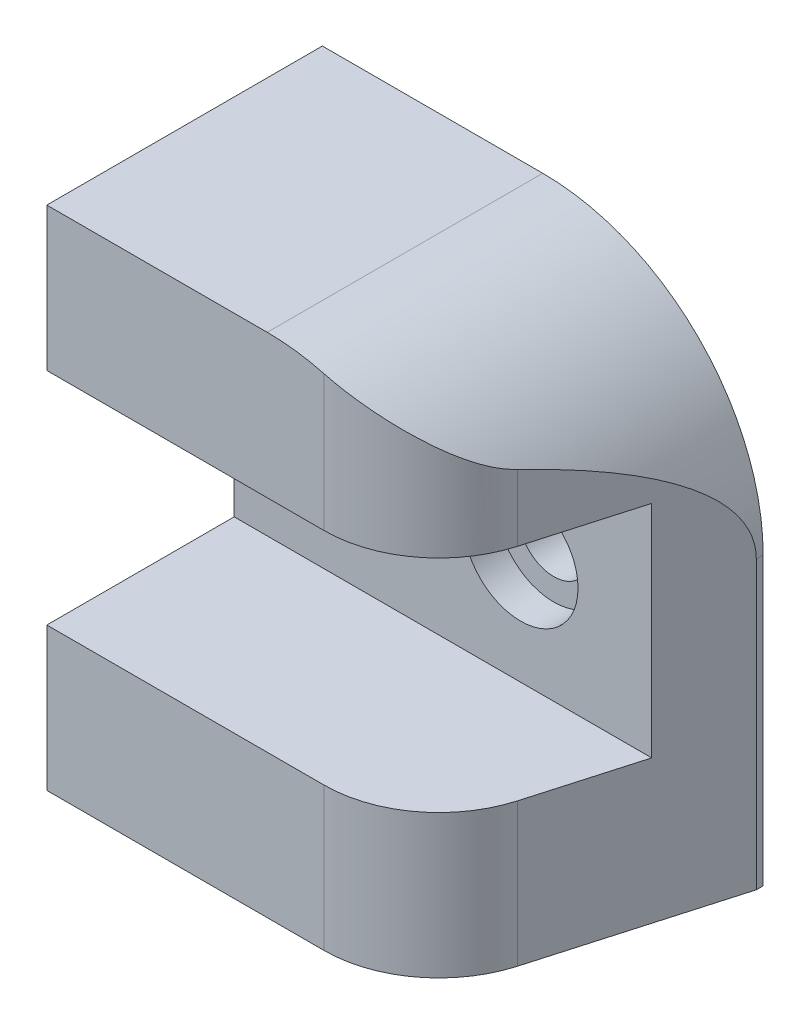
from build123d import *

# Parameters (mm, degrees)
EXTRUDE_1_DEPTH              = 12.5
CUT_EXTRUDE_1_DEPTH          = 26.5
SKETCH_3_W                   = 20
SKETCH_3_H                   = 10
CUT_EXTRUDE_2_DEPTH          = 8.5
HOLE_WIZARD_M3_1_D           = 3.2
HOLE_WIZARD_M3_1_CBORE_D     = 5.2
HOLE_WIZARD_M3_1_CBORE_DEPTH = 1.5


with BuildPart() as part:
    # 草图1 → 凸台-拉伸1 (new body)
    with BuildSketch(Plane.XY):
        with BuildLine():
            Line((130, 82), (110, 82))
            Line((110, 82), (110, 105))
            Line((110, 105), (120, 105))
            ThreePointArc((120, 105), (127.071067812, 102.071067812), (130, 95))
            Line((130, 95), (130, 82))
        make_face()
    extrude(amount=EXTRUDE_1_DEPTH)

    # 草图2 → 切除-拉伸1 (cut)
    with BuildSketch(Plane(origin=(0, 105, 0), x_dir=(1, 0, 0), z_dir=(0, 1, 0))):
        with BuildLine():
            Line((127.585381626, -8.731991651), (130.006476625, -0.288629981))
            Line((130.006476625, -0.288629981), (130.323618549, -12.5))
            Line((130.323618549, -12.5), (122.585065658, -12.5))
            ThreePointArc((122.585065658, -12.5), (125.715602621, -11.452536985), (127.585381626, -8.731991651))
        make_face()
    extrude(amount=-CUT_EXTRUDE_1_DEPTH, mode=Mode.SUBTRACT)

    # 草图3 → 切除-拉伸2 (cut)
    with BuildSketch(Plane.XY.offset(12.5)):
        with Locations((120, 93.5)):
            Rectangle(SKETCH_3_W, SKETCH_3_H)
    extrude(amount=-CUT_EXTRUDE_2_DEPTH, mode=Mode.SUBTRACT)

    # M3 六角头螺栓的柱形沉头孔1 (through all)
    with Locations(Plane.XY.offset(4)):
        with Locations((115, 93.5), (123, 93.5)):
            CounterBoreHole(HOLE_WIZARD_M3_1_D / 2, HOLE_WIZARD_M3_1_CBORE_D / 2, HOLE_WIZARD_M3_1_CBORE_DEPTH)


solid = part.part
